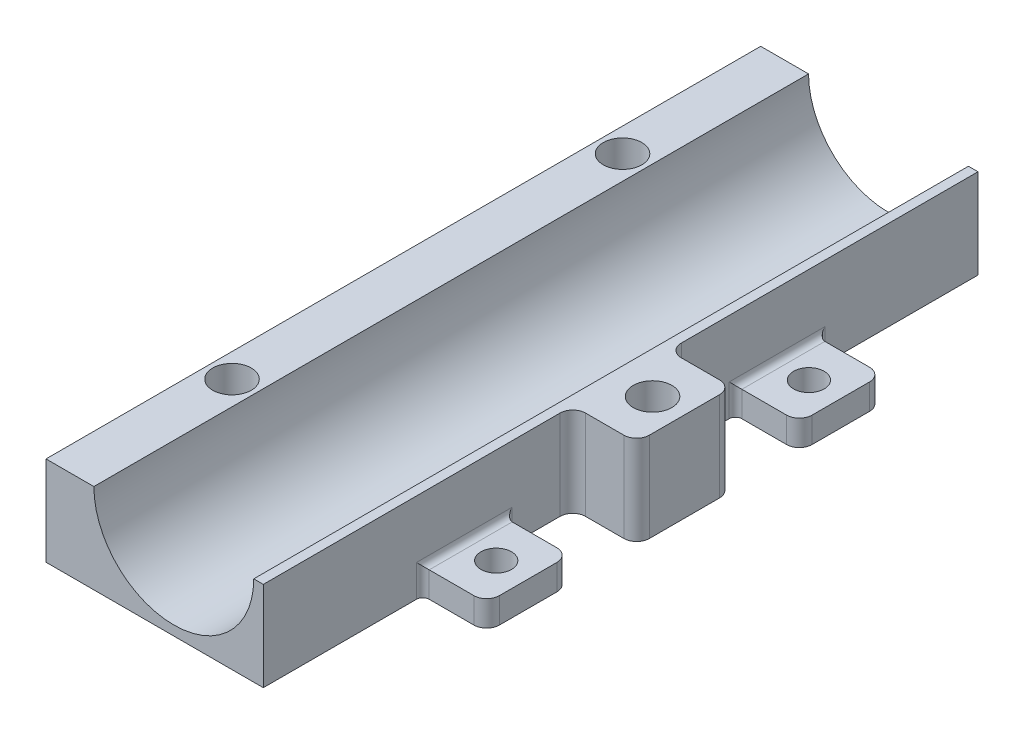
from build123d import *

# Parameters (mm, degrees)
BOSS_EXTRUDE1_DEPTH  = 112
SKETCH3_W            = 11
SKETCH3_H            = 11
BOSS_EXTRUDE2_DEPTH  = 4
BOSS_EXTRUDE3_REACH  = 127.251
SKETCH8_W            = 10
SKETCH8_H            = 13
BOSS_EXTRUDE4_DEPTH  = 4
FILLET1_R            = 2
M4_CLEARANCE_HOLE1_D = 4.8
MIRROR1_START        = 13.844633107
MIRROR1_OUTLINE_W    = 4
MIRROR1_OUTLINE_H    = 13
MIRROR1_DEPTH        = 2.782266793
MIRROR1_START_2      = 21.4269001
MIRROR1_2_OUTLINE_W  = 4
MIRROR1_2_OUTLINE_H  = 13
MIRROR1_2_DEPTH      = 0.5999999
MIRROR1_START_3      = 74
MIRROR1_3_DEPTH      = 13
MIRROR1_4_OUTLINE_W  = 4.8000002
MIRROR1_4_OUTLINE_H  = 4
MIRROR1_4_DEPTH      = 4.0999999
MIRROR1_START_4      = 82.9000001
MIRROR1_5_OUTLINE_W  = 4.8000002
MIRROR1_5_OUTLINE_H  = 4
MIRROR1_5_DEPTH      = 4.0999999
MIRROR1_START_5      = 76
MIRROR1_6_OUTLINE_W  = 2
MIRROR1_6_OUTLINE_H  = 4
MIRROR1_6_DEPTH      = 9
MIRROR1_START_6      = -14.0269
MIRROR1_7_DEPTH      = 4
CUT_EXTRUDE2_DEPTH   = 126.72521882
BOSS_EXTRUDE5_START  = -87
BOSS_EXTRUDE5_DEPTH  = 112
SKETCH14_W           = 112
SKETCH14_H           = 14.0269
BOSS_EXTRUDE6_DEPTH  = 1
SKETCH2_R            = 3.025
CUT_EXTRUDE1_DEPTH   = 8
SKETCH15_W           = 10
SKETCH15_H           = 15
SKETCH15_R           = 3.025
BOSS_EXTRUDE7_DEPTH  = 14.0269
SKETCH16_R           = 3.025
CUT_EXTRUDE3_DEPTH   = 8
FILLET2_R            = 2
FILLET3_R            = 1


with BuildPart() as part:
    # Sketch1 → Boss-Extrude1 (new body)
    with BuildSketch(Plane.XY):
        with BuildLine():
            ThreePointArc((0, -14.0269), (-9.918516109, -9.918516109), (-14.0269, 0))
            Line((-14.0269, 0), (-19.0269, 0))
            Line((-19.0269, 0), (-19.0269, -14.0269))
            Line((-19.0269, -14.0269), (0, -14.0269))
        make_face()
        with BuildLine():
            Line((-12.5269, 0), (-14.0269, 0))
            ThreePointArc((-14.0269, 0), (-9.918516109, -9.918516109), (0, -14.0269))
            ThreePointArc((0, -14.0269), (9.918516109, -9.918516109), (14.0269, 0))
            Line((14.0269, 0), (12.5269, 0))
            ThreePointArc((12.5269, 0), (0, -12.5269), (-12.5269, 0))
        make_face()
    extrude(amount=BOSS_EXTRUDE1_DEPTH)

    # Sketch3 → Boss-Extrude2 (add)
    with BuildSketch(Plane.XZ.offset(14.0269)):
        with Locations((-13.5269, 117.5)):
            Rectangle(SKETCH3_W, SKETCH3_H)
    extrude(amount=-BOSS_EXTRUDE2_DEPTH)

    # Sketch7 → Boss-Extrude3 (add, up to next)
    with BuildSketch(Plane.XZ.offset(14.0269), mode=Mode.PRIVATE) as boss_extrude3_sk1:
        Polygon((0, 25), (14.0269, 25), (14.0269, 31.5), (14.0269, 38), (0, 38), align=None)
    boss_extrude3_tool1 = extrude(boss_extrude3_sk1.sketch, amount=-BOSS_EXTRUDE3_REACH, mode=Mode.PRIVATE) - part.part
    add(boss_extrude3_tool1.solids().sort_by_distance((7.01345, -14.0269, 31.5))[0])

    # Sketch8 → Boss-Extrude4 (add)
    with BuildSketch(Plane.XZ.offset(14.0269)):
        with Locations((19.0269, 31.5)):
            Rectangle(SKETCH8_W, SKETCH8_H)
    extrude(amount=-BOSS_EXTRUDE4_DEPTH)

    # Fillet1
    fillet1_edges = [part.edges().sort_by_distance(p)[0] for p in [
        (-19.0269, -12.0269, 123),
        (-8.0269, -12.0269, 123),
        (24.0269, -12.0269, 38),
        (24.0269, -12.0269, 25),
    ]]
    fillet(fillet1_edges, radius=FILLET1_R)

    # M4 Clearance Hole1 (through all)
    with Locations(Plane(origin=(0, -10.0269, 0), x_dir=(1, 0, 0), z_dir=(0, 1, 0))):
        with Locations((-13.5269, -117.5), (19.0269, -31.5)):
            Hole(M4_CLEARANCE_HOLE1_D / 2)



with BuildPart() as body_2:
    # Mirror1: read off the stored shape, not the designer's step
    # Mirror1 outline → Mirror1 (new body)
    with BuildSketch(Plane.YZ.offset(MIRROR1_START)):
        with Locations((-12.0269, 80.5)):
            Rectangle(MIRROR1_OUTLINE_W, MIRROR1_OUTLINE_H)
    extrude(amount=MIRROR1_DEPTH)


with BuildPart() as body_3:
    # Mirror1 2 outline → Mirror1 2 (new body)
    with BuildSketch(Plane.YZ.offset(MIRROR1_START_2)):
        with Locations((-12.0269, 80.5)):
            Rectangle(MIRROR1_2_OUTLINE_W, MIRROR1_2_OUTLINE_H)
    extrude(amount=MIRROR1_2_DEPTH)


with BuildPart() as part_1:
    add(part.part)

    add(body_2.part)  # Mirror1 3 merges body 2
    # Mirror1 3 outline → Mirror1 3 (add)
    with BuildSketch(Plane.XY.offset(MIRROR1_START_3)):
        with BuildLine():
            Line((16.6268999, -10.0269), (14.0269, -10.0269))
            Line((14.0269, -10.0269), (14.0269, 0))
            ThreePointArc((14.0269, 0), (9.918516109, -9.918516109), (0, -14.0269))
            Line((0, -14.0269), (13.844633107, -14.0269))
            Line((13.844633107, -14.0269), (16.6268999, -14.0269))
            Line((16.6268999, -14.0269), (16.6268999, -10.0269))
        make_face()
    extrude(amount=MIRROR1_3_DEPTH)


    add(body_3.part)  # Mirror1 4 merges body 3
    # Mirror1 4 outline → Mirror1 4 (add)
    with BuildSketch(Plane.XY.offset(MIRROR1_START_3)):
        with Locations((19.0269, -12.0269)):
            Rectangle(MIRROR1_4_OUTLINE_W, MIRROR1_4_OUTLINE_H)
    extrude(amount=MIRROR1_4_DEPTH)

    # Mirror1 5 outline → Mirror1 5 (add)
    with BuildSketch(Plane.XY.offset(MIRROR1_START_4)):
        with Locations((19.0269, -12.0269)):
            Rectangle(MIRROR1_5_OUTLINE_W, MIRROR1_5_OUTLINE_H)
    extrude(amount=MIRROR1_5_DEPTH)

    # Mirror1 6 outline → Mirror1 6 (add)
    with BuildSketch(Plane.XY.offset(MIRROR1_START_5)):
        with Locations((23.0269, -12.0269)):
            Rectangle(MIRROR1_6_OUTLINE_W, MIRROR1_6_OUTLINE_H)
    extrude(amount=MIRROR1_6_DEPTH)

    # Mirror1 7 outline → Mirror1 7 (add)
    with BuildSketch(Plane(origin=(0, 0, 0), x_dir=(1, 0, 0), z_dir=(0, 1, 0)).offset(MIRROR1_START_6)):
        with BuildLine():
            ThreePointArc((24.0269, -76), (23.441113562, -74.585786438), (22.0269, -74))
            Line((22.0269, -74), (22.0269, -76))
            Line((22.0269, -76), (24.0269, -76))
        make_face()
        with BuildLine():
            Line((22.0269, -85), (22.0269, -87))
            ThreePointArc((22.0269, -87), (23.441113562, -86.414213562), (24.0269, -85))
            Line((24.0269, -85), (22.0269, -85))
        make_face()
        with BuildLine():
            Line((21.4269001, -82.9000001), (21.4269, -80.5))
            ThreePointArc((21.4269, -80.5), (20.723956275, -82.197056275), (19.0269, -82.9))
            Line((19.0269, -82.9), (21.4269001, -82.9000001))
        make_face()
        with BuildLine():
            ThreePointArc((19.0269, -78.1), (20.723956275, -78.802943725), (21.4269, -80.5))
            Line((21.4269, -80.5), (21.4269001, -78.0999999))
            Line((21.4269001, -78.0999999), (19.0269, -78.1))
        make_face()
        with BuildLine():
            ThreePointArc((16.6269, -80.5), (17.329843725, -78.802943725), (19.0269, -78.1))
            Line((19.0269, -78.1), (16.6268999, -78.0999999))
            Line((16.6268999, -78.0999999), (16.6269, -80.5))
        make_face()
        with BuildLine():
            Line((16.6268999, -82.9000001), (19.0269, -82.9))
            ThreePointArc((19.0269, -82.9), (17.329843725, -82.197056275), (16.6269, -80.5))
            Line((16.6269, -80.5), (16.6268999, -82.9000001))
        make_face()
    extrude(amount=MIRROR1_7_DEPTH)

    # Sketch12 → Cut-Extrude2 (cut, through all)
    with BuildSketch(Plane(origin=(0, -10.0269, 0), x_dir=(1, 0, 0), z_dir=(0, 1, 0))):
        with BuildLine():
            Line((-19.0269, -112), (-19.0269, -121))
            ThreePointArc((-19.0269, -121), (-18.441113562, -122.414213562), (-17.0269, -123))
            Line((-17.0269, -123), (-10.0269, -123))
            ThreePointArc((-10.0269, -123), (-8.612686438, -122.414213562), (-8.0269, -121))
            Line((-8.0269, -121), (-8.0269, -112))
            Line((-8.0269, -112), (-19.0269, -112))
        make_face()
    extrude(amount=-CUT_EXTRUDE2_DEPTH, mode=Mode.SUBTRACT)

    # Sketch13 → Boss-Extrude5 (add)
    with BuildSketch(Plane.XY.offset(87).offset(BOSS_EXTRUDE5_START)):
        with BuildLine():
            Line((14.0269, -14.0269), (14.0269, -10.0269))
            Line((14.0269, -10.0269), (14.0269, 0))
            ThreePointArc((14.0269, 0), (9.918516109, -9.918516109), (0, -14.0269))
            Line((0, -14.0269), (14.0269, -14.0269))
        make_face()
    extrude(amount=BOSS_EXTRUDE5_DEPTH)

    # Sketch14 → Boss-Extrude6 (add)
    with BuildSketch(Plane.ZY.offset(19.0269)):
        with Locations((56, -7.01345)):
            Rectangle(SKETCH14_W, SKETCH14_H)
    extrude(amount=BOSS_EXTRUDE6_DEPTH)

    # Sketch2 → Cut-Extrude1 (cut)
    with BuildSketch(Plane(origin=(0, 0, 0), x_dir=(1, 0, 0), z_dir=(0, 1, 0))):
        with Locations(Location((-16.2769, -25.4, 0), (0, 0, 180))):
            Circle(SKETCH2_R)
        with Locations(Location((-16.2769, -86.6, 0), (0, 0, 180))):
            Circle(SKETCH2_R)
    extrude(amount=-CUT_EXTRUDE1_DEPTH, mode=Mode.SUBTRACT)

    # Sketch15 → Boss-Extrude7 (add)
    # profile 1 of 2: a face of its own
    with BuildSketch(Plane.XZ.offset(14.0269)):
        with Locations((19.0269, 56)):
            Rectangle(SKETCH15_W, SKETCH15_H)
        with Locations((19.0269, 56)):
            Circle(SKETCH15_R, mode=Mode.SUBTRACT)
    # profile 2 of 2: a face of its own
    with BuildSketch(Plane.XZ.offset(14.0269)):
        with Locations((19.0269, 56)):
            Circle(SKETCH15_R)
    extrude(amount=-BOSS_EXTRUDE7_DEPTH)

    # Sketch16 → Cut-Extrude3 (cut)
    with BuildSketch(Plane(origin=(0, 0, 0), x_dir=(1, 0, 0), z_dir=(0, 1, 0))):
        with Locations(Location((19.0269, -56, 0), (0, 0, 270))):
            Circle(SKETCH16_R)
    extrude(amount=-CUT_EXTRUDE3_DEPTH, mode=Mode.SUBTRACT)

    # Fillet2
    fillet2_edges = [part_1.edges().sort_by_distance(p)[0] for p in [
        (24.0269, -7.01345, 63.5),
        (24.0269, -7.01345, 48.5),
        (14.0269, -7.01345, 48.5),
        (14.0269, -7.01345, 63.5),
    ]]
    fillet(fillet2_edges, radius=FILLET2_R)

    # Fillet3
    fillet3_edges = [part_1.edges().sort_by_distance(p)[0] for p in [
        (14.0269, -10.0269, 80.5),
        (14.0269, -12.0269, 25),
        (14.0269, -12.0269, 38),
        (14.0269, -12.0269, 74),
        (14.0269, -12.0269, 87),
        (14.0269, -10.0269, 31.5),
    ]]
    fillet(fillet3_edges, radius=FILLET3_R)


solid = part_1.part
